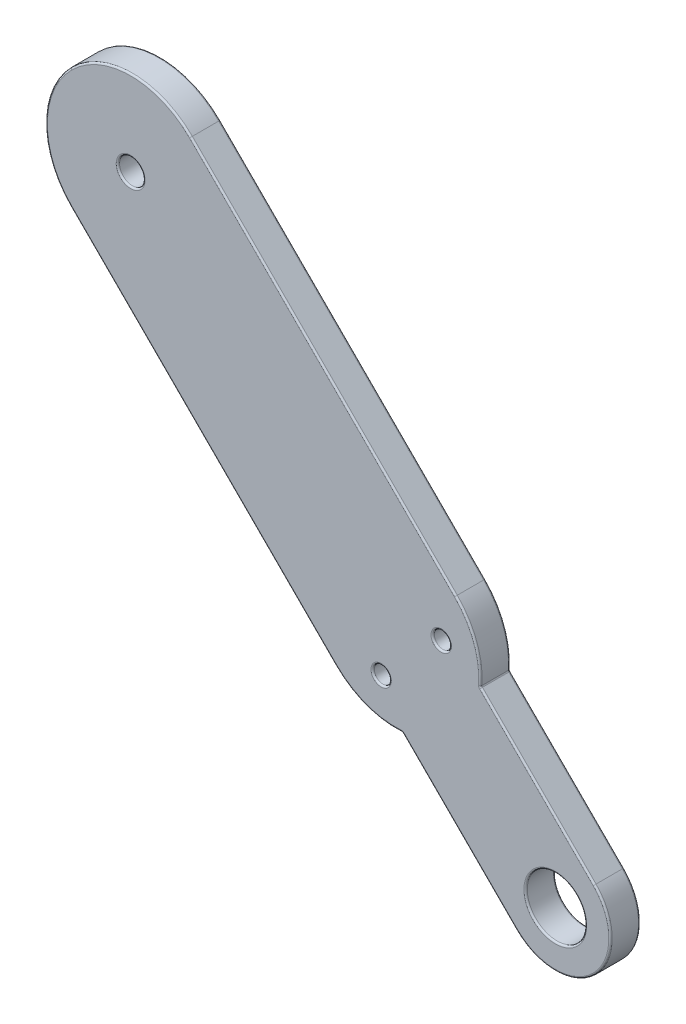
from build123d import *

# Parameters (mm, degrees)
SKETCH3_R           = 3.5
SKETCH3_R_2         = 1
SKETCH3_R_3         = 1.5
BOSS_EXTRUDE1_DEPTH = 3.5
FILLET1_R           = 10
FILLET2_R           = 0.2


with BuildPart() as part:
    # Sketch3 → Boss-Extrude1 (new body)
    with BuildSketch(Plane.XY):
        with BuildLine():
            Line((-50, 35.857864376), (-64.142135624, 50))
            Line((-64.142135624, 50), (-50, 64.142135624))
            Line((-50, 64.142135624), (-6.363961031, 20.506096654))
            Line((-6.363961031, 20.506096654), (-8.838834765, 18.03122292))
            Line((-8.838834765, 18.03122292), (4.596194078, 4.596194078))
            ThreePointArc((4.596194078, 4.596194078), (4.596194078, -4.596194078), (-4.596194078, -4.596194078))
            Line((-4.596194078, -4.596194078), (-18.03122292, 8.838834765))
            Line((-18.03122292, 8.838834765), (-20.506096654, 6.363961031))
            Line((-20.506096654, 6.363961031), (-50, 35.857864376))
        make_face()
        Circle(SKETCH3_R, mode=Mode.SUBTRACT)
        with Locations((-20.506096654, 13.435028843)):
            Circle(SKETCH3_R_2, mode=Mode.SUBTRACT)
        with Locations((-13.435028843, 20.506096654)):
            Circle(SKETCH3_R_2, mode=Mode.SUBTRACT)
        with Locations((-50, 50)):
            Circle(SKETCH3_R_3, mode=Mode.SUBTRACT)
    extrude(amount=BOSS_EXTRUDE1_DEPTH)

    # Fillet1
    # the kernel refuses this fillet: 10 mm, written as the material it takes off along each edge
    with BuildSketch(Plane(origin=(-20.506096654, 6.363961031, -18.998355192), x_dir=(-0.7071067811865481, 0.7071067811865469, 0), z_dir=(0, 0, 1))) as fillet1_piece_1:
        with BuildLine():
            CenterArc((7.599342077, -10), FILLET1_R, 90, 49.458398126)
            Line((0, -3.5), (-0.151986842, -3.37))
            ThreePointArc((-0.151986842, -3.37), (-0.2, -1.75), (-0.2, 0))
            Line((-0.2, 0), (0, 0.2))
            Line((0, 0.2), (7.599342077, 0.2))
            Line((7.599342077, 0.2), (7.599342077, 0))
        make_face()
    extrude(amount=41.496710384, mode=Mode.SUBTRACT)
    with BuildSketch(Plane(origin=(-6.363961031, 20.506096654, -18.998355192), x_dir=(-0.7071067811865438, -0.7071067811865513, 0), z_dir=(0, 0, 1))) as fillet1_piece_2:
        with BuildLine():
            CenterArc((10, -7.599342077), FILLET1_R, 130.541601874, 49.458398126)
            Line((0, -7.599342077), (-0.2, -7.599342077))
            Line((-0.2, -7.599342077), (-0.2, 0))
            Line((-0.2, 0), (0, 0.2))
            ThreePointArc((0, 0.2), (1.75, 0.2), (3.37, 0.151986842))
            Line((3.37, 0.151986842), (3.5, 0))
        make_face()
    extrude(amount=41.496710384, mode=Mode.SUBTRACT)
    with BuildSketch(Plane(origin=(-64.142135624, 50, -25), x_dir=(0.7071067811865476, -0.7071067811865476, 0), z_dir=(0, 0, 1))) as fillet1_piece_3:
        with BuildLine():
            CenterArc((FILLET1_R, FILLET1_R), FILLET1_R, 180, 90)
            Line((0, FILLET1_R), (-FILLET1_R * 0.02, FILLET1_R))
            Line((-FILLET1_R * 0.02, FILLET1_R), (-FILLET1_R * 0.02, -FILLET1_R * 0.02))
            Line((-FILLET1_R * 0.02, -FILLET1_R * 0.02), (FILLET1_R, -FILLET1_R * 0.02))
            Line((FILLET1_R, -FILLET1_R * 0.02), (FILLET1_R, 0))
        make_face()
    extrude(amount=53.5, mode=Mode.SUBTRACT)
    with BuildSketch(Plane(origin=(-50, 64.142135624, -25), x_dir=(0.7071067811865489, -0.7071067811865461, 0), z_dir=(0, 0, 1))) as fillet1_piece_4:
        with BuildLine():
            CenterArc((FILLET1_R, -FILLET1_R), FILLET1_R, 90, 90)
            Line((0, -FILLET1_R), (-FILLET1_R * 0.02, -FILLET1_R))
            Line((-FILLET1_R * 0.02, -FILLET1_R), (-FILLET1_R * 0.02, FILLET1_R * 0.02))
            Line((-FILLET1_R * 0.02, FILLET1_R * 0.02), (FILLET1_R, FILLET1_R * 0.02))
            Line((FILLET1_R, FILLET1_R * 0.02), (FILLET1_R, 0))
        make_face()
    extrude(amount=53.5, mode=Mode.SUBTRACT)

    # Fillet2
    fillet2_edges = [part.edges().sort_by_distance(p)[0] for p in [
        (-2.121320344, 11.313708499, 0),
        (4.596194078, -4.596194078, 0),
        (-11.313708499, 2.121320344, 0),
        (-8.838834765, 18.03122292, 1.75),
        (-18.03122292, 8.838834765, 1.75),
        (-11.313708499, 2.121320344, 3.5),
        (-3.5, 0, 0),
        (-3.5, 0, 3.5),
        (4.596194078, -4.596194078, 3.5),
        (-21.506096654, 13.435028843, 0),
        (-21.506096654, 13.435028843, 3.5),
        (-2.121320344, 11.313708499, 3.5),
        (-14.435028843, 20.506096654, 0),
        (-14.435028843, 20.506096654, 3.5),
        (-51.5, 50, 0),
        (-51.5, 50, 3.5),
        (-27.333219767, 41.475355391, 0),
        (-41.475355391, 27.333219767, 0),
        (-57.071067812, 57.071067812, 0),
        (-57.071067812, 57.071067812, 0),
        (-9.427918977, 22.273151555, 0),
        (-22.273151555, 9.427918977, 0),
        (-41.475355391, 27.333219767, 3.5),
        (-27.333219767, 41.475355391, 3.5),
        (-57.071067812, 57.071067812, 3.5),
        (-57.071067812, 57.071067812, 3.5),
        (-9.427918977, 22.273151555, 3.5),
        (-22.273151555, 9.427918977, 3.5),
    ]]
    fillet(fillet2_edges, radius=FILLET2_R)


solid = part.part
